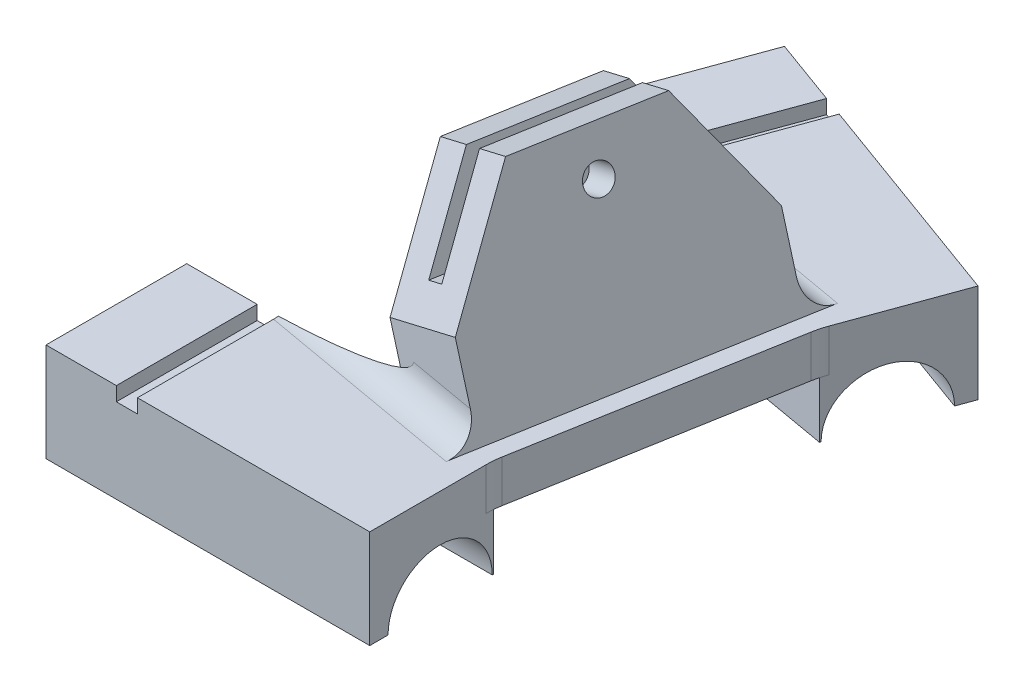
from build123d import *

# Parameters (mm, degrees)
SKETCH2_W           = 58.42
SKETCH2_H           = 25.4
BOSS_EXTRUDE1_DEPTH = 17.78
CUT_EXTRUDE2_DEPTH  = 63.372388122
SKETCH6_W           = 3.81
SKETCH6_H           = 2.54
CUT_EXTRUDE3_DEPTH  = 25.4
CUT_EXTRUDE4_DEPTH  = 25.4
SKETCH8_W           = 17.78
SKETCH8_H           = 17.78
BOSS_EXTRUDE2_DEPTH = 25.4
SKETCH13_W          = 58.42
SKETCH13_H          = 9.398
CUT_EXTRUDE6_REACH  = 59.763
SKETCH15_W          = 25.4
SKETCH15_H          = 10.16
MIRROR14_START      = 9.31703521
MIRROR14_OUTLINE_W  = 7.62
MIRROR14_OUTLINE_H  = 25.4
MIRROR14_DEPTH      = 17.78
CUT_EXTRUDE7_DEPTH  = 25.4
BOSS_EXTRUDE3_DEPTH = 35.56
CUT_EXTRUDE8_REACH  = 128.018
CUT_EXTRUDE9_REACH  = 111.199
CUT_EXTRUDE10_REACH = 128.018
SKETCH25_R          = 2.4765
SKETCH26_R          = 3.81
CUT_EXTRUDE11_DEPTH = 5.08
FILLET1_R           = 15.24
FILLET2_R           = 5.08


with BuildPart() as part:
    # Sketch2 → Boss-Extrude1 (new body)
    with BuildSketch(Plane(origin=(0, 0, 0), x_dir=(1, 0, 0), z_dir=(0, 1, 0))):
        Rectangle(SKETCH2_W, SKETCH2_H)
    boss_extrude1 = extrude(amount=BOSS_EXTRUDE1_DEPTH)

    # Sketch4 → Cut-Extrude2 (cut, symmetric)
    with BuildSketch(Plane.ZY.offset(29.21)):
        with BuildLine():
            Line((-9.398, -66.725655712), (-9.398, 0))
            ThreePointArc((-9.398, 0), (0, 9.398), (9.398, 0))
            Line((9.398, 0), (9.398, -66.725655712))
            Line((9.398, -66.725655712), (9.398, -200.176967137))
            Line((9.398, -200.176967137), (-9.398, -200.176967137))
            Line((-9.398, -200.176967137), (-9.398, -66.725655712))
        make_face()
    cut_extrude2 = extrude(amount=CUT_EXTRUDE2_DEPTH, both=True, mode=Mode.SUBTRACT)

    # Sketch6 → Cut-Extrude3 (cut)
    with BuildSketch(Plane(origin=(0, 0, -12.7), x_dir=(-1, 0, 0), z_dir=(0, 0, -1))):
        with Locations((14.605, 16.51)):
            Rectangle(SKETCH6_W, SKETCH6_H)
    cut_extrude3 = extrude(amount=-CUT_EXTRUDE3_DEPTH, mode=Mode.SUBTRACT)

    # Sketch7 → Cut-Extrude4 (cut)
    with BuildSketch(Plane(origin=(0, 17.78, 0), x_dir=(1, 0, 0), z_dir=(0, 1, 0))):
        Polygon((11.700118151, 12.7), (29.21, 9.612535401), (29.21, 12.7), align=None)
    extrude(amount=-CUT_EXTRUDE4_DEPTH, mode=Mode.SUBTRACT)

    # Sketch8 → Boss-Extrude2 (add)
    with BuildSketch(Plane(origin=(2.524629641, 0, -14.317886186), x_dir=(-0.9848077530122094, 0, -0.17364817766692317), z_dir=(0.17364817766692317, 0, -0.9848077530122094))):
        with Locations((-18.20703521, 8.89)):
            Rectangle(SKETCH8_W, SKETCH8_H)
    extrude(amount=BOSS_EXTRUDE2_DEPTH)

    # Sketch13 → Cut-Revolve2 (revolve, cut)
    with BuildSketch(Plane.XZ):
        with Locations((0, 4.699)):
            Rectangle(SKETCH13_W, SKETCH13_H)
    revolve(axis=Axis((28.421300087, 0, 0), (-1, 0, 0)), mode=Mode.SUBTRACT)

    # Sketch15 → Cut-Extrude6 (cut, up to next)
    with BuildSketch(Plane(origin=(9.17548851, 0, 1.617886186), x_dir=(-0.17364817766692317, 0, 0.9848077530122095), z_dir=(-0.9848077530122095, 0, -0.17364817766692317)), mode=Mode.PRIVATE) as cut_extrude6_sk1:
        with Locations((-27.238762659, 5.08)):
            Rectangle(SKETCH15_W, SKETCH15_H)
    cut_extrude6_tool1 = extrude(cut_extrude6_sk1.sketch, amount=-CUT_EXTRUDE6_REACH, mode=Mode.PRIVATE) & part.part
    cut_extrude6 = cut_extrude6_tool1.solids().sort_by_distance((13.90545, 5.08, -25.207058))[0]
    add(cut_extrude6, mode=Mode.SUBTRACT)

    # Mirror14: read off the stored shape, not the designer's step
    # Mirror14 outline → Mirror14 (add)
    with BuildSketch(Plane(origin=(0, 0, 0), x_dir=(0, 1, 0), z_dir=(0.9848077530122094, 0, 0.17364817766692306)).offset(MIRROR14_START)):
        with Locations((13.97, -52.638762659)):
            Rectangle(MIRROR14_OUTLINE_W, MIRROR14_OUTLINE_H)
    extrude(amount=MIRROR14_DEPTH)

    # Mirror15: Boss-Extrude1 across plane
    add(boss_extrude1.mirror(Plane(origin=(6.935293354, 0, -39.332003112), x_dir=(0.9848077530122092, 0, 0.17364817766692314), z_dir=(0.17364817766692314, 0, -0.9848077530122094))))

    # Mirror16: Cut-Extrude2, Cut-Extrude3, Cut-Extrude6 across plane
    add(cut_extrude2.mirror(Plane(origin=(6.935293354, 0, -39.332003112), x_dir=(0.9848077530122092, 0, 0.17364817766692314), z_dir=(0.17364817766692314, 0, -0.9848077530122094))), mode=Mode.SUBTRACT)
    add(cut_extrude3.mirror(Plane(origin=(6.935293354, 0, -39.332003112), x_dir=(0.9848077530122092, 0, 0.17364817766692314), z_dir=(0.17364817766692314, 0, -0.9848077530122094))), mode=Mode.SUBTRACT)
    add(cut_extrude6.mirror(Plane(origin=(6.935293354, 0, -39.332003112), x_dir=(0.9848077530122092, 0, 0.17364817766692314), z_dir=(0.17364817766692314, 0, -0.9848077530122094))), mode=Mode.SUBTRACT)

    # Sketch21 → Cut-Extrude7 (cut, symmetric)
    with BuildSketch(Plane(origin=(6.935293354, 0, -39.332003112), x_dir=(-0.9848077530122094, 0, -0.17364817766692314), z_dir=(0.17364817766692314, 0, -0.9848077530122094))):
        Polygon((-23.83567521, 17.78), (-9.31703521, 12.495647198), (-9.31703521, 17.78), align=None)
    extrude(amount=CUT_EXTRUDE7_DEPTH, both=True, mode=Mode.SUBTRACT)

    # Sketch22 → Boss-Extrude3 (add)
    with BuildSketch(Plane(origin=(-2.881682913, 8.039496752, -0.508118447), x_dir=(-0.19346054761682988, -0.00733712504048707, 0.9810806200878379), z_dir=(-0.33682408883345943, 0.9396926207859106, -0.059391174613881166))):
        Polygon((-65.934673992, 27.071104434), (-15.146364467, 28.160882213), (-14.814917266, 12.714023803), (-65.603226791, 11.624246024), align=None)
    extrude(amount=BOSS_EXTRUDE3_DEPTH)

    # Sketch23 → Cut-Extrude8 (cut, up to next)
    with BuildSketch(Plane(origin=(26.355240658, 9.740503248, 4.647140011), x_dir=(0.3782029195796047, -0.8606292095735792, -0.3409984094540904), z_dir=(0.9254165783983268, 0.3420201433256624, 0.16317591116652866)), mode=Mode.PRIVATE) as cut_extrude8_sk1:
        Polygon((-19.269639975, 65.921874736), (4.43963551, 69.395008187), (-14.170689985, 77.55332817), align=None)
    cut_extrude8_tool1 = extrude(cut_extrude8_sk1.sketch, amount=-CUT_EXTRUDE8_REACH, mode=Mode.PRIVATE) & part.part
    # Sketch23 → Cut-Extrude8 (cut, up to next)
    with BuildSketch(Plane(origin=(26.355240658, 9.740503248, 4.647140011), x_dir=(0.3782029195796047, -0.8606292095735792, -0.3409984094540904), z_dir=(0.9254165783983268, 0.3420201433256624, 0.16317591116652866)), mode=Mode.PRIVATE) as cut_extrude8_sk2:
        Polygon((-15.956164448, 22.869194448), (-34.566489944, 31.027514432), (-29.467539954, 42.658967866), align=None)
    cut_extrude8_tool2 = extrude(cut_extrude8_sk2.sketch, amount=-CUT_EXTRUDE8_REACH, mode=Mode.PRIVATE) & part.part
    add(cut_extrude8_tool1.solids().sort_by_distance((24.388361, 44.830618, -57.747753))[0], mode=Mode.SUBTRACT)
    add(cut_extrude8_tool2.solids().sort_by_distance((17.037255, 44.830618, -16.057558))[0], mode=Mode.SUBTRACT)

    # Cut-Extrude9: up to this plane
    cut_extrude9_end = Plane(origin=(-45.924606639, 26.595398182, -61.548547649), z_dir=(0.031263049894144905, -0.49803609294534235, 0.8665925639163162))
    # Sketch24 → Cut-Extrude9 (cut, up to the surface)
    with BuildSketch(Plane(origin=(2.524629641, 0, -14.317886186), x_dir=(-0.9848077530122095, 0, -0.1736481776669232), z_dir=(0.1736481776669232, 0, -0.9848077530122095)), mode=Mode.PRIVATE) as cut_extrude9_sk1:
        Polygon((-8.170546151, 33.702451643), (-11.082465645, 34.762303663), (-5.87007866, 49.083219204), (-2.958159167, 48.023367184), align=None)
    cut_extrude9_tool1 = split(extrude(cut_extrude9_sk1.sketch, amount=CUT_EXTRUDE9_REACH, mode=Mode.PRIVATE), bisect_by=cut_extrude9_end, keep=Keep.BOTH, mode=Mode.PRIVATE)
    add(cut_extrude9_tool1.solids().sort_by_distance((9.438288, 41.392835, -13.098822))[0], mode=Mode.SUBTRACT)

    # Cut-Extrude10: up to this face of the body (flat: up to its plane)
    cut_extrude10_end = Plane(part.part.faces().sort_by_distance((10.739934643, 27.479568088, -38.661142201))[0])
    # Sketch25 → Cut-Extrude10 (cut, up to the picked face)
    with BuildSketch(Plane(origin=(26.355240658, 9.740503248, 4.647140011), x_dir=(0.3782029195796047, -0.8606292095735792, -0.3409984094540904), z_dir=(0.9254165783983268, 0.3420201433256624, 0.16317591116652866)), mode=Mode.PRIVATE) as cut_extrude10_sk1:
        with Locations(Location((-17.389717904, 51.231051307, 0), (0, 0, 159.779686777))):
            Circle(SKETCH25_R)
    cut_extrude10_tool1 = split(extrude(cut_extrude10_sk1.sketch, amount=-CUT_EXTRUDE10_REACH, mode=Mode.PRIVATE), bisect_by=cut_extrude10_end, keep=Keep.BOTH, mode=Mode.PRIVATE)
    add(cut_extrude10_tool1.solids().sort_by(Axis((20.997986, 44.035012, -36.852371), (-0.9254165783983268, -0.3420201433256624, -0.16317591116652866)))[0], mode=Mode.SUBTRACT)

    # Sketch26 → Cut-Extrude11 (cut)
    with BuildSketch(Plane.XZ.offset(-10.16)):
        with Locations(Location((24.865722788, -36.170384627, 0), (0, 0, 270))):
            Circle(SKETCH26_R)
    extrude(amount=-CUT_EXTRUDE11_DEPTH, mode=Mode.SUBTRACT)

    # Fillet1
    fillet1_edges = [part.edges().sort_by_distance(p)[0] for p in [
        (29.21, 13.97, -9.612535401),
        (38.031327425, 13.97, -59.640769254),
    ]]
    fillet(fillet1_edges, radius=FILLET1_R)

    # Fillet2
    # the kernel refuses this fillet: 5.08 mm, written as the material it adds along each edge
    with BuildSketch(Plane(origin=(-16.999729813, 17.78, -69.344229422), x_dir=(0.17364817766692311, 0, -0.9848077530122094), z_dir=(0.9848077530122094, 0, 0.17364817766692314))) as fillet2_piece_1_section:
        with BuildLine():
            CenterArc((FILLET2_R, FILLET2_R), FILLET2_R, 180, 90)
            Line((0, FILLET2_R), (0, 0))
            Line((0, 0), (FILLET2_R, 0))
        make_face()
    fillet2_piece_1 = extrude(amount=65.31864, mode=Mode.PRIVATE)
    fillet2_piece_1 = split(fillet2_piece_1, bisect_by=Plane(origin=(28.757814695, 34.691304915, -61.275939754), z_dir=(-0.925416578398327, -0.34202014332566266, -0.16317591116652855)), keep=Keep.TOP, mode=Mode.PRIVATE)
    fillet2_piece_1 = split(fillet2_piece_1, bisect_by=Plane(origin=(-4.669969149, 17.78, -64.856563545), z_dir=(0.9396926207859135, 0, 0.342020143325655)), keep=Keep.TOP, mode=Mode.PRIVATE)
    fillet2_piece_1 = split(fillet2_piece_1, bisect_by=Plane(origin=(-14.73692606, 17.78, -75.561231638), z_dir=(0.342020143325655, 0, -0.9396926207859134)), keep=Keep.TOP, mode=Mode.PRIVATE)
    add(fillet2_piece_1)
    with BuildSketch(Plane(origin=(-25.821057238, 17.78, -19.315995569), x_dir=(-0.17364817766692314, 0, 0.9848077530122094), z_dir=(0.9848077530122094, 0, 0.17364817766692314))) as fillet2_piece_2_section:
        with BuildLine():
            CenterArc((FILLET2_R, -FILLET2_R), FILLET2_R, 90, 90)
            Line((0, -FILLET2_R), (0, 0))
            Line((0, 0), (FILLET2_R, 0))
        make_face()
    fillet2_piece_2 = extrude(amount=65.31864, mode=Mode.PRIVATE)
    fillet2_piece_2 = split(fillet2_piece_2, bisect_by=Plane(origin=(-12.7, 17.78, -19.315995569), z_dir=(1, 0, 0)), keep=Keep.TOP, mode=Mode.PRIVATE)
    fillet2_piece_2 = split(fillet2_piece_2, bisect_by=Plane(origin=(-25.821057238, 17.78, -12.7), z_dir=(0, 0, 1)), keep=Keep.TOP, mode=Mode.PRIVATE)
    fillet2_piece_2 = split(fillet2_piece_2, bisect_by=Plane(origin=(19.93648727, 34.691304915, -11.247705901), z_dir=(-0.925416578398327, -0.34202014332566266, -0.16317591116652855)), keep=Keep.TOP, mode=Mode.PRIVATE)
    add(fillet2_piece_2)


solid = part.part
